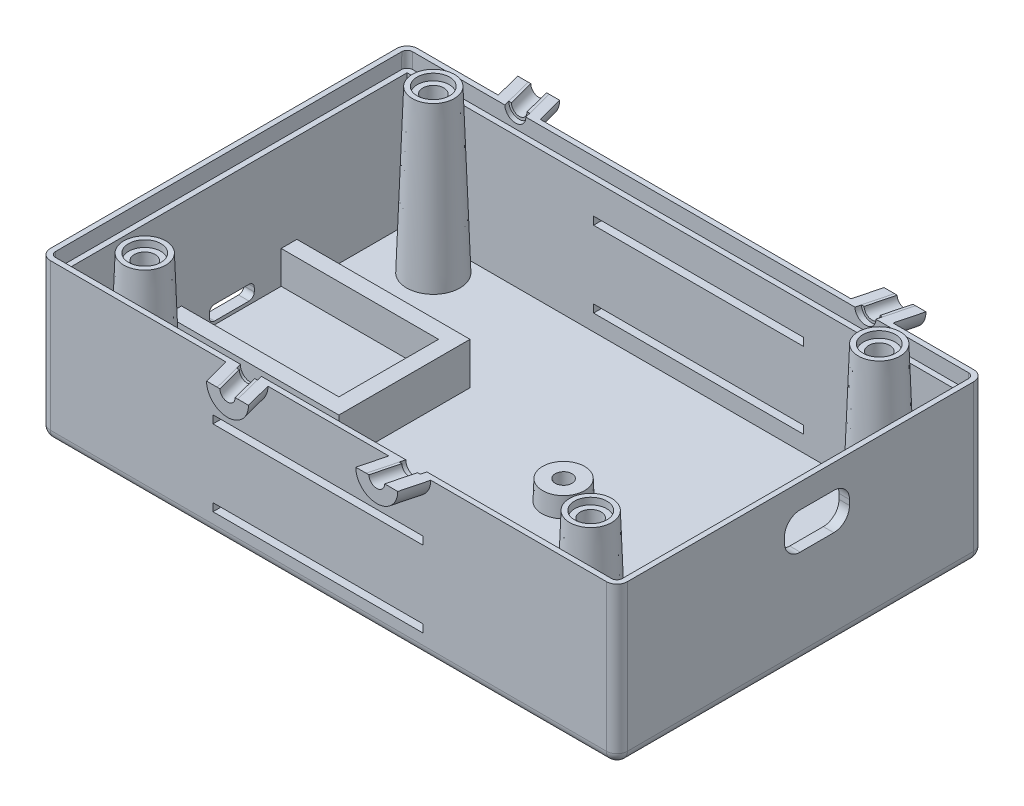
from build123d import *

# Parameters (mm, degrees)
BOSS_EXTRUDE1_DEPTH = 30
FILLET1_R           = 2
SHELL1_START        = -53
SHELL1_OUTLINE_W    = 28.000000000000004
SHELL1_OUTLINE_H    = 66
SHELL1_DEPTH        = 106
CUT_EXTRUDE1_DEPTH  = 3
CUT_EXTRUDE1_DRAFT  = 1.0000000000000022
CUT_EXTRUDE3_DEPTH  = 2
CUT_EXTRUDE4_DEPTH  = 2
SKETCH29_R          = 2.0000000000000036
SKETCH48_W          = 40
SKETCH48_H          = 1.5000000000000009
CUT_EXTRUDE5_DEPTH  = 5
SKETCH49_W          = 40
SKETCH49_H          = 1.5000000000000036
CUT_EXTRUDE6_DEPTH  = 5
SKETCH51_W          = 40
SKETCH51_H          = 1.5
CUT_EXTRUDE7_DEPTH  = 5
CUT_EXTRUDE8_DEPTH  = 5
BOSS_EXTRUDE2_DEPTH = 8
BOSS_EXTRUDE3_DEPTH = 1.75


# Read off the part's stored shape, not the designer's step: Shell1, Mounting Boss3, Mounting Boss4, Mounting Boss5, Mounting Boss6, Mounting Boss7
with BuildPart() as part:
    # Sketch2 → Boss-Extrude1 (new body)
    with BuildSketch(Plane(origin=(0, 0, 0), x_dir=(1, 0, 0), z_dir=(0, 1, 0))):
        Polygon((-55.000000000000014, 35), (54.99999999999999, 35), (55.00000000000001, -35), (-55, -35), align=None)
    extrude(amount=BOSS_EXTRUDE1_DEPTH)

    # Fillet1
    fillet1_edges = [part.edges().sort_by_distance(p)[0] for p in [
        (7.11e-15, 0, 35),
        (-55.00000000000001, 0, 0),
        (-1.421e-14, 0, -35),
        (55, 0, 0),
        (55.00000000000001, 15, 35),
        (-55, 15, 35),
        (-55.000000000000014, 15, -35),
        (54.99999999999999, 15, -35),
    ]]
    fillet(fillet1_edges, radius=FILLET1_R)

    # Shell1 outline → Shell1 (cut)
    with BuildSketch(Plane.YZ.offset(SHELL1_START)):
        with Locations((16, 0)):
            Rectangle(SHELL1_OUTLINE_W, SHELL1_OUTLINE_H)
    extrude(amount=SHELL1_DEPTH, mode=Mode.SUBTRACT)


with BuildPart() as cut_extrude1_tool:
    # Sketch4 → Cut-Extrude1 (with draft: the straight prism first)
    with BuildSketch(Plane(origin=(0, 30, 0), x_dir=(1, 0, 0), z_dir=(0, 1, 0))):
        with BuildLine():
            Line((54.00000000000001, -33), (54, 33))
            ThreePointArc((54, 33), (53.707106781186546, 33.707106781186546), (53, 34))
            Line((53, 34), (-53.000000000000014, 34))
            ThreePointArc((-53.000000000000014, 34), (-53.70710678118656, 33.707106781186546), (-54.000000000000014, 33))
            Line((-54.000000000000014, 33), (-54, -33))
            ThreePointArc((-54, -33), (-53.707106781186546, -33.707106781186546), (-53, -34))
            Line((-53, -34), (53.000000000000014, -34))
            ThreePointArc((53.000000000000014, -34), (53.70710678118656, -33.707106781186546), (54.00000000000001, -33))
        make_face()
    extrude(amount=-CUT_EXTRUDE1_DEPTH)
    # Cut-Extrude1: the draft: its side faces are tilted about the plane it starts from
    cut_extrude1_sides = [cut_extrude1_tool.faces().sort_by_distance(p)[0] for p in [
        (54, 28.5, 0),
        (53.707106781, 28.5, -33.707106781),
        (0, 28.5, -34),
        (-53.707106781, 28.5, -33.707106781),
        (-54, 28.5, 0),
        (-53.707106781, 28.5, 33.707106781),
        (0, 28.5, 34),
        (53.707106781, 28.5, 33.707106781),
    ]]
    draft(cut_extrude1_sides, Plane(origin=(0, 30, 0), x_dir=(1, 0, 0), z_dir=(0, 1, 0)), CUT_EXTRUDE1_DRAFT)


with BuildPart() as part_1:
    add(part.part)

    # Cut-Extrude1: cut by cut_extrude1_tool
    add(cut_extrude1_tool.part, mode=Mode.SUBTRACT)

    # Mounting Boss3 outline → Mounting Boss3 (revolve)
    with BuildSketch(Plane(origin=(42.5, 0, -27.5), x_dir=(1, 0, 0), z_dir=(0, 0, 1))):
        Polygon((4, 32.746), (3.093348776, 32.746), (3.060721118, 31.5), (2, 31.5), (1.851631948, 23), (0, 23), (0, 2), (5.073938557, 2), align=None)
    revolve(axis=Axis((42.5, 0, -27.5), (0, 1, 0)))

    # Mounting Boss4 outline → Mounting Boss4 (revolve)
    with BuildSketch(Plane(origin=(42.5, 0, 27.5), x_dir=(1, 0, 0), z_dir=(0, 0, 1))):
        Polygon((4, 32.746), (3.093348776, 32.746), (3.060721118, 31.5), (2, 31.5), (1.851631948, 23), (0, 23), (0, 2), (5.073938557, 2), align=None)
    revolve(axis=Axis((42.5, 0, 27.5), (0, 1, 0)))

    # Mounting Boss5 outline → Mounting Boss5 (revolve)
    with BuildSketch(Plane(origin=(-42.5, 0, -27.5), x_dir=(1, 0, 0), z_dir=(0, 0, 1))):
        Polygon((4, 32.746), (3.093348776, 32.746), (3.060721118, 31.5), (2, 31.5), (1.851631948, 23), (0, 23), (0, 2), (5.073938557, 2), align=None)
    revolve(axis=Axis((-42.5, 0, -27.5), (0, 1, 0)))

    # Mounting Boss6 outline → Mounting Boss6 (revolve)
    with BuildSketch(Plane(origin=(-42.5, 0, 27.5), x_dir=(1, 0, 0), z_dir=(0, 0, 1))):
        Polygon((4, 32.746), (3.093348776, 32.746), (3.060721118, 31.5), (2, 31.5), (1.851631948, 23), (0, 23), (0, 2), (5.073938557, 2), align=None)
    revolve(axis=Axis((-42.5, 0, 27.5), (0, 1, 0)))

    # Mounting Boss7 outline → Mounting Boss7 (revolve, cut)
    with BuildSketch(Plane(origin=(48.008201566, 0, 10.162400936), x_dir=(1, 0, 0), z_dir=(0, 0, 1))):
        Polygon((1.512899226, 1), (1.530354291, 2), (0, 2), (0, 1), align=None)
    mounting_boss7 = revolve(axis=Axis((48.008201566, 0, 10.162400936), (0, 1, 0)), mode=Mode.SUBTRACT)

    # Mounting Boss7 2 outline → Mounting Boss7 2 (revolve)
    with BuildSketch(Plane(origin=(48.008201566, 0, 10.162400936), x_dir=(1, 0, 0), z_dir=(0, 0, 1))):
        Polygon((4, 5.746), (1.595740964, 5.746), (1.530354291, 2), (4.130846305, 2), align=None)
    mounting_boss7_2 = revolve(axis=Axis((48.008201566, 0, 10.162400936), (0, 1, 0)))

    # Sketch-Pattern5: Mounting Boss7, Mounting Boss7 2 at 2 more places
    with Locations((-40.366, 0, -12.357001), (0, 0, -24.510002)):
        add(mounting_boss7, mode=Mode.SUBTRACT)
        add(mounting_boss7_2)

    # Sketch16 → Cut-Extrude3 (cut)
    with BuildSketch(Plane.ZY.offset(-53)):
        with BuildLine():
            Line((-6.333075850096779, 18.409749030000004), (0.06734967138067369, 18.409749030000004))
            ThreePointArc((0.06734967138067369, 18.409749030000004), (2.188670014940319, 19.288428686440362), (3.0673496713806743, 21.409749030000008))
            Line((3.0673496713806743, 21.409749030000008), (3.067349671380674, 22.38800558))
            ThreePointArc((3.067349671380674, 22.38800558), (2.188670014940316, 24.509325923559643), (0.06734967138067319, 25.38800558))
            Line((0.06734967138067319, 25.38800558), (-6.333075850096779, 25.388005580000005))
            ThreePointArc((-6.333075850096779, 25.388005580000005), (-8.454396193656422, 24.509325923559643), (-9.33307585009678, 22.38800558))
            Line((-9.33307585009678, 22.38800558), (-9.33307585009678, 21.409749030000008))
            ThreePointArc((-9.33307585009678, 21.409749030000008), (-8.454396193656423, 19.288428686440362), (-6.333075850096779, 18.409749030000004))
        make_face()
    extrude(amount=-CUT_EXTRUDE3_DEPTH, mode=Mode.SUBTRACT)

    # Sketch17 → Cut-Extrude4 (cut)
    with BuildSketch(Plane(origin=(-53.00000000000001, 0, 1.051e-14), x_dir=(-2e-16, 0, -1), z_dir=(1, 0, -2e-16))):
        with BuildLine():
            Line((-4.700909603162279, 5.37557361387065), (-4.700909603162279, 6.13625929820693))
            ThreePointArc((-4.700909603162279, 6.13625929820693), (-4.4080163843488265, 6.843366079393485), (-3.7009096031622715, 7.136259298206937))
            Line((-3.7009096031622715, 7.136259298206937), (2.8719039492320846, 7.136259298206937))
            ThreePointArc((2.8719039492320846, 7.136259298206937), (3.579010730418639, 6.843366079393485), (3.8719039492320917, 6.13625929820693))
            Line((3.8719039492320917, 6.13625929820693), (3.8719039492320917, 5.37557361387065))
            ThreePointArc((3.8719039492320917, 5.37557361387065), (3.579010730418639, 4.668466832684095), (2.8719039492320846, 4.3755736138706425))
            Line((2.8719039492320846, 4.3755736138706425), (-3.7009096031622715, 4.3755736138706425))
            ThreePointArc((-3.7009096031622715, 4.3755736138706425), (-4.4080163843488265, 4.668466832684095), (-4.700909603162279, 5.37557361387065))
        make_face()
    extrude(amount=-CUT_EXTRUDE4_DEPTH, mode=Mode.SUBTRACT)

    # Cut-Sweep2: sweep along a path in Sketch26
    with BuildLine(Plane(origin=(0, 30, 0), x_dir=(1, 0, 0), z_dir=(0, 1, 0))) as cut_sweep2_path:
        Line((34.91337388804527, 39.99999999999999), (0, -95))
        Line((0, -95), (-34.91337388804526, 39.99999999999999))
    # Sketch29 → Cut-Sweep2 (sweep, cut)
    with BuildSketch(Plane(origin=(0, 0, -40), x_dir=(-1, 0, 0), z_dir=(0, 0, -1))):
        with Locations((34.91337388804526, 30)):
            Circle(SKETCH29_R)
    sweep(path=cut_sweep2_path.line, transition=Transition.RIGHT, mode=Mode.SUBTRACT)

    # Sweep10: sweep along a path in Sketch35
    with BuildLine(Plane(origin=(0, 30, 0), x_dir=(1, 0, 0), z_dir=(0, 1, 0))) as sweep10_path:
        Line((33.62028596626583, 35), (34.91337388804527, 39.99999999999999))
    # Sketch34 → Sweep10 (sweep)
    with BuildSketch(Plane(origin=(0, 0, -35), x_dir=(-1, 0, 0), z_dir=(0, 0, -1))):
        with BuildLine():
            Line((-37.62028596626583, 30.000000000000004), (-35.62028596626583, 30.000000000000007))
            Line((-35.62028596626583, 30.000000000000007), (-35.12028596626583, 30.000000000000007))
            ThreePointArc((-35.12028596626583, 30.000000000000007), (-33.62028596626583, 28.499999999999996), (-32.12028596626583, 30.000000000000007))
            Line((-32.12028596626583, 30.000000000000007), (-31.62028596626583, 30.000000000000004))
            Line((-31.62028596626583, 30.000000000000004), (-29.62028596626583, 29.999999999999996))
            ThreePointArc((-29.62028596626583, 29.999999999999996), (-33.62028596626584, 25.999999999999996), (-37.62028596626583, 30.000000000000004))
        make_face()
    sweep(path=sweep10_path.line)

    # Sweep11: sweep along a path in Sketch37
    with BuildLine(Plane(origin=(0, 30, 0), x_dir=(1, 0, 0), z_dir=(0, 1, 0))) as sweep11_path:
        Line((-33.620285966265804, 35), (-34.91337388804526, 39.99999999999999))
    # Sketch36 → Sweep11 (sweep)
    with BuildSketch(Plane(origin=(0, 0, -35), x_dir=(-1, 0, 0), z_dir=(0, 0, -1))):
        with BuildLine():
            Line((31.6202859662658, 30.000000000000004), (32.120285966265804, 30))
            ThreePointArc((32.120285966265804, 30), (33.620285966265804, 28.5), (35.120285966265804, 30))
            Line((35.120285966265804, 30), (35.620285966265804, 30))
            Line((35.620285966265804, 30), (37.620285966265804, 30))
            ThreePointArc((37.620285966265804, 30), (33.620285966265804, 25.999999999999996), (29.6202859662658, 30))
            Line((29.6202859662658, 30), (31.6202859662658, 30.000000000000004))
        make_face()
    sweep(path=sweep11_path.line)

    # Sweep12: sweep along a path in Sketch39
    with BuildLine(Plane(origin=(0, 30, 0), x_dir=(1, 0, 0), z_dir=(0, 1, 0))) as sweep12_path:
        Line((-15.517055061353444, -35), (-14.223967139573995, -40))
    # Sketch38 → Sweep12 (sweep)
    with BuildSketch(Plane.XY.offset(35)):
        with BuildLine():
            Line((-19.51705506135345, 30.000000000000004), (-17.477488256276388, 30.000000000000007))
            Line((-17.477488256276388, 30.000000000000007), (-16.977488256276388, 30.000000000000007))
            ThreePointArc((-16.977488256276388, 30.000000000000007), (-15.517055061353444, 28.53956680507705), (-14.056621866430504, 30.000000000000007))
            Line((-14.056621866430504, 30.000000000000007), (-13.556621866430504, 30.000000000000004))
            Line((-13.556621866430504, 30.000000000000004), (-11.517055061353442, 29.999999999999996))
            ThreePointArc((-11.517055061353442, 29.999999999999996), (-15.517055061353448, 25.999999999999993), (-19.51705506135345, 30.000000000000004))
        make_face()
    sweep(path=sweep12_path.line)

    # Sweep14: sweep along a path in Sketch47
    with BuildLine(Plane(origin=(0, 30, 0), x_dir=(1, 0, 0), z_dir=(0, 1, 0))) as sweep14_path:
        Line((15.517055061353462, -35), (14.223967139574011, -40))
    # Sketch46 → Sweep14 (sweep)
    with BuildSketch(Plane.XY.offset(35)):
        with BuildLine():
            Line((11.517055061353458, 30), (13.517055061353458, 30))
            Line((13.517055061353458, 30), (14.01705506135346, 30))
            ThreePointArc((14.01705506135346, 30), (15.517055061353462, 28.5), (17.017055061353467, 30))
            Line((17.017055061353467, 30), (17.56003819125013, 30))
            Line((17.56003819125013, 30), (19.517055061353467, 30))
            ThreePointArc((19.517055061353467, 30), (15.517055061353462, 25.999999999999996), (11.517055061353458, 30))
        make_face()
    sweep(path=sweep14_path.line)

    # Sketch48 → Cut-Extrude5 (cut)
    with BuildSketch(Plane(origin=(0, 0, -35), x_dir=(-1, 0, 0), z_dir=(0, 0, -1))):
        with Locations((-2.5501994424348453, 5.858128431544458)):
            Rectangle(SKETCH48_W, SKETCH48_H)
    extrude(amount=-CUT_EXTRUDE5_DEPTH, mode=Mode.SUBTRACT)

    # Sketch49 → Cut-Extrude6 (cut)
    with BuildSketch(Plane(origin=(0, 0, -35), x_dir=(-1, 0, 0), z_dir=(0, 0, -1))):
        with Locations((-2.5501994424348453, 20.358128431544458)):
            Rectangle(SKETCH49_W, SKETCH49_H)
    extrude(amount=-CUT_EXTRUDE6_DEPTH, mode=Mode.SUBTRACT)

    # Sketch51 → Cut-Extrude7 (cut)
    with BuildSketch(Plane.XY.offset(35)):
        with Locations((-1.9972518043607401, 4.787724396603494)):
            Rectangle(SKETCH51_W, SKETCH51_H)
    extrude(amount=-CUT_EXTRUDE7_DEPTH, mode=Mode.SUBTRACT)

    # Sketch52 → Cut-Extrude8 (cut)
    with BuildSketch(Plane.XY.offset(35)):
        Polygon((-21.99725180436074, 20.037724396603497), (18.00274819563926, 20.037724396603494), (18.00274819563926, 18.53772439660349), (-21.99725180436074, 18.53772439660349), align=None)
    extrude(amount=-CUT_EXTRUDE8_DEPTH, mode=Mode.SUBTRACT)

    # Sketch54 → Boss-Extrude2 (add)
    with BuildSketch(Plane(origin=(0, 2, 0), x_dir=(1, 0, 0), z_dir=(0, 1, 0))):
        Polygon((-53.000000000000014, 9.000000000000002), (-23.000000000000007, 9.000000000000007), (-23.000000000000007, -9.999999999999991), (-53.00000000000001, -9.999999999999995), (-53.000000000000014, -12.999999999999998), (-20.00000000000001, -12.99999999999999), (-20.00000000000001, 12.000000000000005), (-53.000000000000014, 12), align=None)
    extrude(amount=BOSS_EXTRUDE2_DEPTH)

    # Sketch55 → Boss-Extrude3 (add)
    with BuildSketch(Plane(origin=(0, 2, 0), x_dir=(1, 0, 0), z_dir=(0, 1, 0))):
        Polygon((-23.000000000000007, -9.999999999999991), (-23.000000000000007, 9.000000000000007), (-53.00000000000001, 9.000000000000002), (-53.00000000000001, -9.999999999999995), align=None)
    extrude(amount=BOSS_EXTRUDE3_DEPTH)


solid = part_1.part
